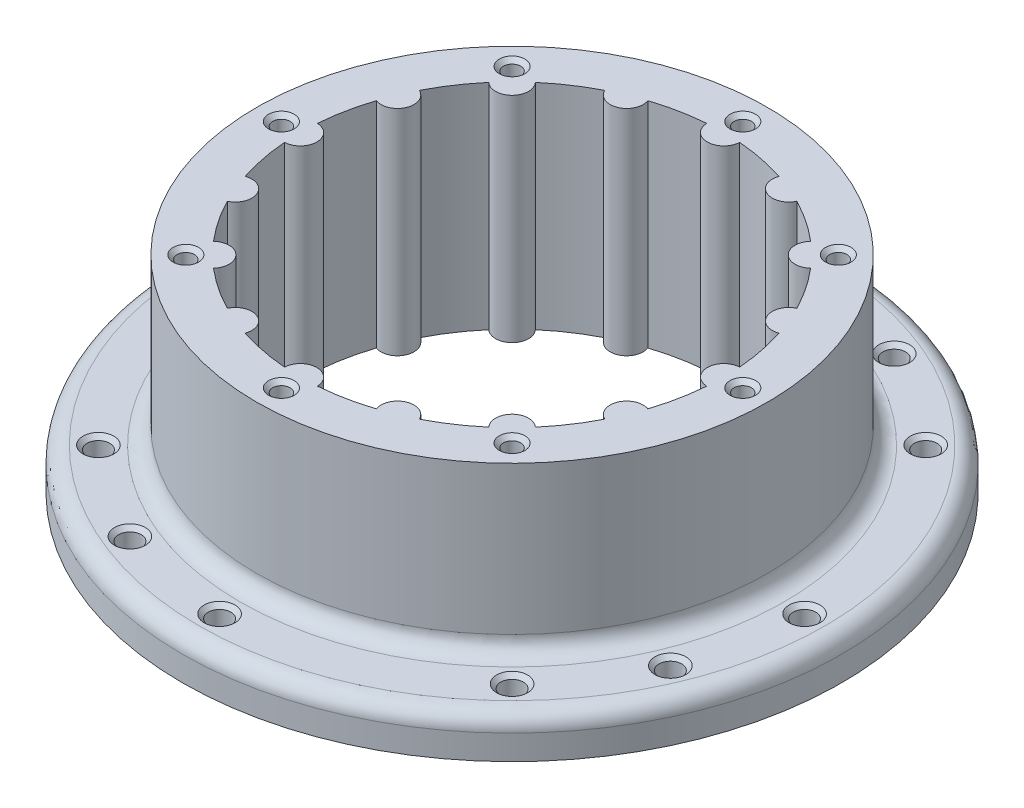
from build123d import *

# Parameters (mm, degrees)
SKETCH1_R                       = 80
SKETCH1_R_2                     = 62
BOSS_EXTRUDE1_DEPTH             = 10
BOSS_EXTRUDE2_DEPTH             = 40
BOSS_EXTRUDE2_DEPTH_BACK        = 12
SKETCH4_R                       = 62
SKETCH4_R_2                     = 51.4
BOSS_EXTRUDE3_REACH             = 122
BOSS_EXTRUDE3_DIRECTION_2_REACH = 122
CIRPATTERN1_COUNT               = 16
SKETCH8_R                       = 2.75
CUT_EXTRUDE4_DEPTH              = 121
CHAMFER1_SIZE                   = 1
CIRPATTERN2_COUNT               = 8
CHAMFER1_OF_CIRPATTERN2_SIZE    = 1
CHAMFER2_SIZE                   = 0.5
SKETCH9_R                       = 2.1
CUT_EXTRUDE5_DEPTH              = 15
CHAMFER3_SIZE                   = 1
SKETCH10_R                      = 2.75
CUT_EXTRUDE6_DEPTH              = 121
CHAMFER4_SIZE                   = 1
CIRPATTERN4_COUNT               = 4
CHAMFER4_OF_CIRPATTERN4_SIZE    = 1
CIRPATTERN3_COUNT               = 8
CHAMFER3_OF_CIRPATTERN3_SIZE    = 1
FILLET1_R                       = 4
FILLET2_R                       = 4


with BuildPart() as part:
    # Sketch1 → Boss-Extrude1 (new body)
    with BuildSketch(Plane(origin=(0, 0, 0), x_dir=(1, 0, 0), z_dir=(0, 1, 0))):
        Circle(SKETCH1_R)
        Circle(SKETCH1_R_2, mode=Mode.SUBTRACT)
    extrude(amount=BOSS_EXTRUDE1_DEPTH)

    # Sketch4 → Boss-Extrude2 (add, two sides: drawn at the far end of the back side and taken through both)
    with BuildSketch(Plane(origin=(0, 10, 0), x_dir=(1, 0, 0), z_dir=(0, 1, 0)).offset(-BOSS_EXTRUDE2_DEPTH_BACK)):
        Circle(SKETCH4_R)
        Circle(SKETCH4_R_2, mode=Mode.SUBTRACT)
    extrude(amount=BOSS_EXTRUDE2_DEPTH + BOSS_EXTRUDE2_DEPTH_BACK)

    # Boss-Extrude3: up to this face of the body (flat: up to its plane)
    boss_extrude3_end = Plane(part.part.faces().sort_by_distance((-60.246375183, 50, 0))[0])
    # Sketch5 → Boss-Extrude3 (add, up to the picked face)
    with BuildSketch(Plane(origin=(0, 10, 0), x_dir=(1, 0, 0), z_dir=(0, 1, 0)), mode=Mode.PRIVATE) as boss_extrude3_sk1:
        with BuildLine():
            ThreePointArc((-51.244357977, -3.996970798), (-47.4, 0), (-51.244357977, 3.996970798))
            ThreePointArc((-51.244357977, 3.996970798), (-51.4, 0), (-51.244357977, -3.996970798))
        make_face()
    boss_extrude3_tool1 = split(extrude(boss_extrude3_sk1.sketch, amount=BOSS_EXTRUDE3_REACH, mode=Mode.PRIVATE), bisect_by=boss_extrude3_end, keep=Keep.BOTH, mode=Mode.PRIVATE)
    boss_extrude3 = boss_extrude3_tool1.solids().sort_by(Axis((-49.674621, 10, 0), (0, 1, 0)))[0]
    add(boss_extrude3)

    # Boss-Extrude3 direction 2: up to this face of the body (flat: up to its plane)
    boss_extrude3_direction_2_end = Plane(part.part.faces().sort_by_distance((-60.246375183, -2, 0))[0])
    # Sketch5 → Boss-Extrude3 direction 2 (add, up to the picked face)
    with BuildSketch(Plane(origin=(0, 10, 0), x_dir=(1, 0, 0), z_dir=(0, 1, 0)), mode=Mode.PRIVATE) as boss_extrude3_direction_2_sk1:
        with BuildLine():
            ThreePointArc((-51.244357977, -3.996970798), (-47.4, 0), (-51.244357977, 3.996970798))
            ThreePointArc((-51.244357977, 3.996970798), (-51.4, 0), (-51.244357977, -3.996970798))
        make_face()
    boss_extrude3_direction_2_tool1 = split(extrude(boss_extrude3_direction_2_sk1.sketch, amount=-BOSS_EXTRUDE3_DIRECTION_2_REACH, mode=Mode.PRIVATE), bisect_by=boss_extrude3_direction_2_end, keep=Keep.BOTH, mode=Mode.PRIVATE)
    boss_extrude3_direction_2 = boss_extrude3_direction_2_tool1.solids().sort_by(Axis((-49.674621, 10, 0), (0, -1, 0)))[0]
    add(boss_extrude3_direction_2)

    # CirPattern1: Boss-Extrude3, Boss-Extrude3 direction 2 ×16 about axis
    cirpattern1_axis = Axis((0, 50, 0), (0, 1, 0))
    add([boss_extrude3.rotate(cirpattern1_axis, i * 360 / CIRPATTERN1_COUNT) for i in range(1, CIRPATTERN1_COUNT)])
    add([boss_extrude3_direction_2.rotate(cirpattern1_axis, i * 360 / CIRPATTERN1_COUNT) for i in range(1, CIRPATTERN1_COUNT)])

    # Sketch8 → Cut-Extrude4 (cut, through all)
    with BuildSketch(Plane(origin=(0, 10, 0), x_dir=(1, 0, 0), z_dir=(0, 1, 0))):
        with Locations((0, 71)):
            Circle(SKETCH8_R)
    cut_extrude4 = extrude(amount=-CUT_EXTRUDE4_DEPTH, mode=Mode.SUBTRACT)

    # Chamfer1
    chamfer1_edges = [part.edges().sort_by_distance(p)[0] for p in [
        (-2.75, 10, -71),
    ]]
    chamfer(chamfer1_edges, length=CHAMFER1_SIZE)

    # CirPattern2: Cut-Extrude4 ×8 about axis
    cirpattern2_axis = Axis((0, 10, 0), (0, 1, 0))
    for i in range(1, CIRPATTERN2_COUNT):
        add(cut_extrude4.rotate(cirpattern2_axis, i * 360 / CIRPATTERN2_COUNT), mode=Mode.SUBTRACT)

    # Chamfer1 of CirPattern2
    chamfer1_of_cirpattern2_edges = [part.edges().sort_by_distance(p)[0] for p in [
        (-52.149125113, 10, -48.260037816),
        (-71, 10, 2.75),
        (-48.260037816, 10, 52.149125113),
        (2.75, 10, 71),
        (52.149125113, 10, 48.260037816),
        (71, 10, -2.75),
        (48.260037816, 10, -52.149125113),
    ]]
    chamfer(chamfer1_of_cirpattern2_edges, length=CHAMFER1_OF_CIRPATTERN2_SIZE)

    # Chamfer2
    chamfer2_edges = [part.edges().sort_by_distance(p)[0] for p in [
        (-62, -2, 0),
    ]]
    chamfer(chamfer2_edges, length=CHAMFER2_SIZE)

    # Sketch9 → Cut-Extrude5 (cut)
    with BuildSketch(Plane(origin=(0, 50, 0), x_dir=(1, 0, 0), z_dir=(0, 1, 0))):
        with Locations((0, 56)):
            Circle(SKETCH9_R)
    cut_extrude5 = extrude(amount=-CUT_EXTRUDE5_DEPTH, mode=Mode.SUBTRACT)

    # Chamfer3
    chamfer3_edges = [part.edges().sort_by_distance(p)[0] for p in [
        (-2.1, 50, -56),
    ]]
    chamfer(chamfer3_edges, length=CHAMFER3_SIZE)

    # Sketch10 → Cut-Extrude6 (cut, through all)
    with BuildSketch(Plane(origin=(0, 10, 0), x_dir=(1, 0, 0), z_dir=(0, 1, 0))):
        with Locations((27.170523698, 65.595446808)):
            Circle(SKETCH10_R)
    cut_extrude6 = extrude(amount=-CUT_EXTRUDE6_DEPTH, mode=Mode.SUBTRACT)

    # Chamfer4
    chamfer4_edges = [part.edges().sort_by_distance(p)[0] for p in [
        (24.420523698, 10, -65.595446808),
    ]]
    chamfer(chamfer4_edges, length=CHAMFER4_SIZE)

    # CirPattern4: Cut-Extrude6 ×4 about axis
    cirpattern4_axis = Axis((0, 10, 0), (0, 1, 0))
    for i in range(1, CIRPATTERN4_COUNT):
        add(cut_extrude6.rotate(cirpattern4_axis, i * 360 / CIRPATTERN4_COUNT), mode=Mode.SUBTRACT)

    # Chamfer4 of CirPattern4
    chamfer4_of_cirpattern4_edges = [part.edges().sort_by_distance(p)[0] for p in [
        (-65.595446808, 10, -24.420523698),
        (-24.420523698, 10, 65.595446808),
        (65.595446808, 10, 24.420523698),
    ]]
    chamfer(chamfer4_of_cirpattern4_edges, length=CHAMFER4_OF_CIRPATTERN4_SIZE)

    # CirPattern3: Cut-Extrude5 ×8 about axis
    cirpattern3_axis = Axis((0, 50, 0), (0, 1, 0))
    for i in range(1, CIRPATTERN3_COUNT):
        add(cut_extrude5.rotate(cirpattern3_axis, i * 360 / CIRPATTERN3_COUNT), mode=Mode.SUBTRACT)

    # Chamfer3 of CirPattern3
    chamfer3_of_cirpattern3_edges = [part.edges().sort_by_distance(p)[0] for p in [
        (-41.082903987, 50, -38.113055506),
        (-56, 50, 2.1),
        (-38.113055506, 50, 41.082903987),
        (2.1, 50, 56),
        (41.082903987, 50, 38.113055506),
        (56, 50, -2.1),
        (38.113055506, 50, -41.082903987),
    ]]
    chamfer(chamfer3_of_cirpattern3_edges, length=CHAMFER3_OF_CIRPATTERN3_SIZE)

    # Fillet1
    fillet1_edges = [part.edges().sort_by_distance(p)[0] for p in [
        (-62, 10, 0),
    ]]
    fillet(fillet1_edges, radius=FILLET1_R)

    # Fillet2
    fillet2_edges = [part.edges().sort_by_distance(p)[0] for p in [
        (-80, 10, 0),
    ]]
    fillet(fillet2_edges, radius=FILLET2_R)


solid = part.part
